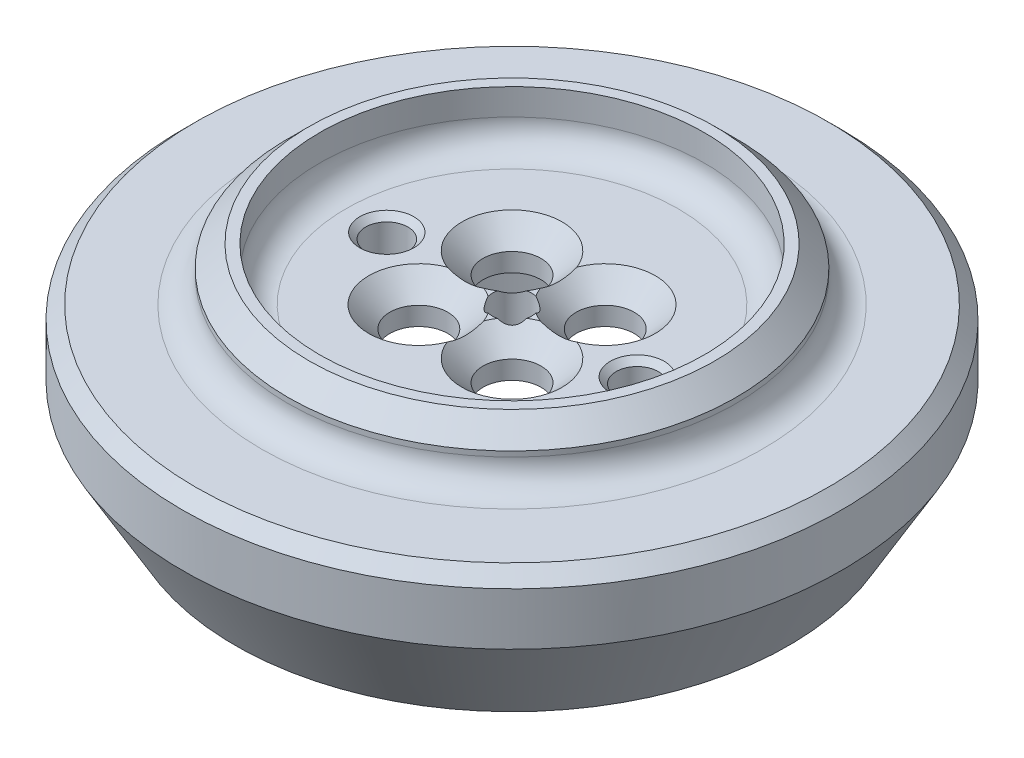
from build123d import *

# Parameters (mm, degrees)
SKETCH1_R                                       = 12.5
BOSS_EXTRUDE1_DEPTH                             = 1.5
CUT_EXTRUDE1_DEPTH                              = 18.741194999
CUT_EXTRUDE1_DEPTH_BACK                         = 18.741194999
SKETCH2_R                                       = 0.75
CSK_FOR_M2_FLAT_HEAD_MACHINE_SCREW1_D           = 2.2
CSK_FOR_M2_FLAT_HEAD_MACHINE_SCREW1_DEPTH       = 5
CSK_FOR_M2_FLAT_HEAD_MACHINE_SCREW1_CSINK_D     = 3.8
CSK_FOR_M2_FLAT_HEAD_MACHINE_SCREW1_CSINK_ANGLE = 90
CSK_FOR_M2_FLAT_HEAD_MACHINE_SCREW1_TIP         = 0.660946681
BOSS_EXTRUDE2_START                             = 3.3
SKETCH7_R                                       = 12.5
SKETCH7_R_2                                     = 7.05
BOSS_EXTRUDE2_DEPTH                             = 3.3
SKETCH15_R                                      = 8.5
SKETCH15_R_2                                    = 7.3
BOSS_EXTRUDE4_DEPTH                             = 2
FILLET1_R                                       = 1
CHAMFER1_SIZE                                   = 0.5
CHAMFER2_SIZE                                   = 1
CHAMFER3_SIZE                                   = 2
CHAMFER3_SIZE2                                  = 3.464101615
M2X0_4_TAPPED_HOLE1_D                           = 1.6
M2X0_4_TAPPED_HOLE1_DEPTH                       = 5.2
M2X0_4_TAPPED_HOLE1_CSINK_D                     = 2.05
M2X0_4_TAPPED_HOLE1_CSINK_ANGLE                 = 90
M2X0_4_TAPPED_HOLE1_TIP                         = 0.480688495
CHAMFER4_SIZE                                   = 0.8


with BuildPart() as part:
    # Sketch1 → Boss-Extrude1 (new body)
    with BuildSketch(Plane(origin=(0, 0, 0), x_dir=(1, 0, 0), z_dir=(0, 1, 0))):
        Circle(SKETCH1_R)
    extrude(amount=BOSS_EXTRUDE1_DEPTH)

    # Sketch2 → Cut-Extrude1 (cut, two sides: drawn at the far end of the back side and taken through both)
    with BuildSketch(Plane(origin=(0, 1.5, 0), x_dir=(1, 0, 0), z_dir=(0, 1, 0)).offset(-CUT_EXTRUDE1_DEPTH_BACK)):
        Circle(SKETCH2_R)
    extrude(amount=CUT_EXTRUDE1_DEPTH + CUT_EXTRUDE1_DEPTH_BACK, mode=Mode.SUBTRACT)

    # CSK for M2 Flat Head Machine Screw1
    with Locations(Plane(origin=(0, 1.5, 0), x_dir=(1, 0, 0), z_dir=(0, 1, 0))):
        with Locations((-1.767766953, 1.767766953), (1.767766953, 1.767766953), (1.767766953, -1.767766953), (-1.767766953, -1.767766953)):
            CounterSinkHole(CSK_FOR_M2_FLAT_HEAD_MACHINE_SCREW1_D / 2, CSK_FOR_M2_FLAT_HEAD_MACHINE_SCREW1_CSINK_D / 2, depth=CSK_FOR_M2_FLAT_HEAD_MACHINE_SCREW1_DEPTH, counter_sink_angle=CSK_FOR_M2_FLAT_HEAD_MACHINE_SCREW1_CSINK_ANGLE)
            with Locations((0, 0, -(CSK_FOR_M2_FLAT_HEAD_MACHINE_SCREW1_DEPTH + CSK_FOR_M2_FLAT_HEAD_MACHINE_SCREW1_TIP / 2))):  # 118° drill point
                Cone(0, CSK_FOR_M2_FLAT_HEAD_MACHINE_SCREW1_D / 2, CSK_FOR_M2_FLAT_HEAD_MACHINE_SCREW1_TIP, mode=Mode.SUBTRACT)

    # Sketch6 → Revolve1 (revolve)
    with BuildSketch(Plane.XY):
        Polygon((-12.5, 0), (-12.5, -1.15), (-7.05, -1.15), (-5, 0), align=None)
    revolve(axis=Axis((0, 0, 0), (0, -1, 0)))

    # Sketch7 → Boss-Extrude2 (add)
    with BuildSketch(Plane.XZ.offset(1.15).offset(BOSS_EXTRUDE2_START)):
        Circle(SKETCH7_R)
        Circle(SKETCH7_R_2, mode=Mode.SUBTRACT)
    extrude(amount=-BOSS_EXTRUDE2_DEPTH)

    # Sketch15 → Boss-Extrude4 (add)
    with BuildSketch(Plane(origin=(0, 1.5, 0), x_dir=(1, 0, 0), z_dir=(0, 1, 0))):
        Circle(SKETCH15_R)
        Circle(SKETCH15_R_2, mode=Mode.SUBTRACT)
    extrude(amount=BOSS_EXTRUDE4_DEPTH)

    # Fillet1
    fillet1_edges = [part.edges().sort_by_distance(p)[0] for p in [
        (5, 0, 0),
        (0, -1.15, 7.05),
        (-7.3, 1.5, 0),
        (-8.5, 1.5, 0),
    ]]
    fillet(fillet1_edges, radius=FILLET1_R)

    # Chamfer1
    chamfer1_edges = [part.edges().sort_by_distance(p)[0] for p in [
        (-12.5, 1.5, 0),
    ]]
    chamfer(chamfer1_edges, length=CHAMFER1_SIZE)

    # Chamfer2
    chamfer2_edges = [part.edges().sort_by_distance(p)[0] for p in [
        (-7.05, -4.45, 0),
    ]]
    chamfer(chamfer2_edges, length=CHAMFER2_SIZE)

    # Chamfer3
    chamfer3_edges = [part.edges().sort_by_distance(p)[0] for p in [
        (-12.5, -4.45, 0),
    ]]
    chamfer3_side = [part.faces().sort_by_distance(p)[0] for p in [
        (-8.403553391, -4.45, 0),
    ]]
    chamfer(chamfer3_edges, length=CHAMFER3_SIZE, length2=CHAMFER3_SIZE2, reference=chamfer3_side[0])

    # M2x0.4 Tapped Hole1
    with Locations(Plane(origin=(0, 1.5, 0), x_dir=(1, 0, 0), z_dir=(0, 1, 0))):
        with Locations((-4.75, 0), (4.75, 0)):
            CounterSinkHole(M2X0_4_TAPPED_HOLE1_D / 2, M2X0_4_TAPPED_HOLE1_CSINK_D / 2, depth=M2X0_4_TAPPED_HOLE1_DEPTH, counter_sink_angle=M2X0_4_TAPPED_HOLE1_CSINK_ANGLE)
            with Locations((0, 0, -(M2X0_4_TAPPED_HOLE1_DEPTH + M2X0_4_TAPPED_HOLE1_TIP / 2))):  # 118° drill point
                Cone(0, M2X0_4_TAPPED_HOLE1_D / 2, M2X0_4_TAPPED_HOLE1_TIP, mode=Mode.SUBTRACT)

    # Chamfer4
    chamfer4_edges = [part.edges().sort_by_distance(p)[0] for p in [
        (-8.5, 3.5, 0),
    ]]
    chamfer(chamfer4_edges, length=CHAMFER4_SIZE)


solid = part.part
